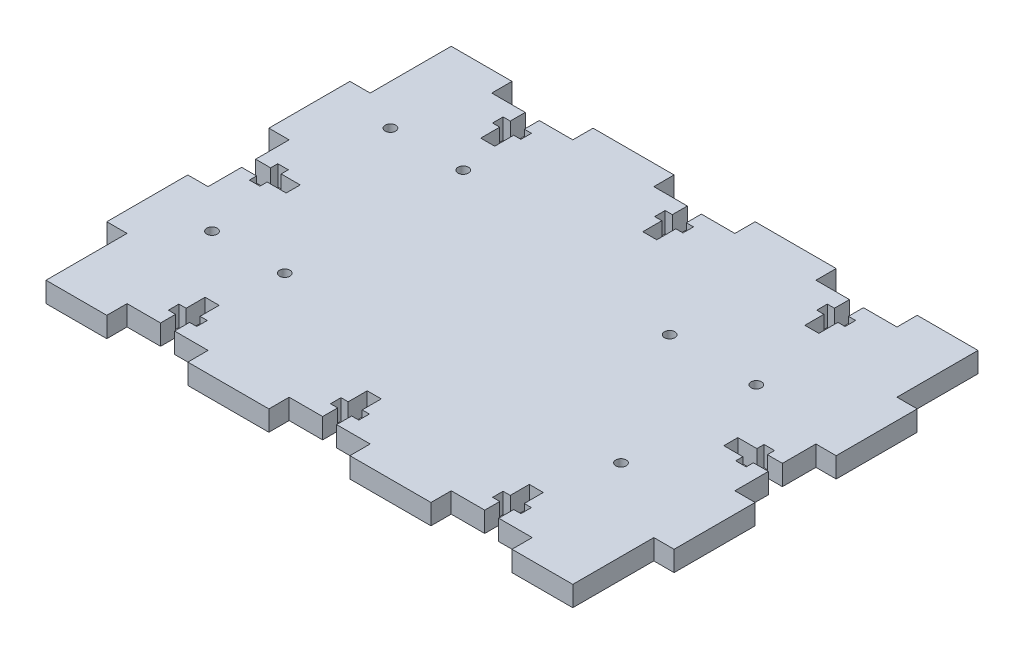
from build123d import *

# Parameters (mm, degrees)
SKETCH1_W                 = 177.8
SKETCH1_H                 = 127
BOSS_EXTRUDE1_DEPTH       = 6.35
SKETCH2_W                 = 6.35
SKETCH2_H                 = 25.4
CUT_EXTRUDE1_DEPTH        = 6.35
LPATTERN1_COUNT           = 3
LPATTERN1_PITCH           = 50.8
LPATTERN1_COUNT_DIR2      = 2
LPATTERN1_PITCH_DIR2      = 171.45
SKETCH3_W                 = 25.4
SKETCH3_H                 = 6.35
CUT_EXTRUDE2_DEPTH        = 6.35
LPATTERN2_COUNT           = 3
LPATTERN2_PITCH           = 50.8
LPATTERN2_COUNT_DIR2      = 2
LPATTERN2_PITCH_DIR2      = 120.65
SKETCH4_W                 = 13.97
SKETCH4_H                 = 4.3942
SKETCH4_W_2               = 3.302
SKETCH4_H_2               = 8.89
CUT_EXTRUDE3_DEPTH        = 8.89
SKETCH5_W                 = 4.3942
SKETCH5_H                 = 13.97
SKETCH5_W_2               = 8.89
SKETCH5_H_2               = 3.302
CUT_EXTRUDE4_DEPTH        = 30.48
LPATTERN3_COUNT           = 3
LPATTERN3_PITCH           = 50.8
MIRROR2_COPY_1_SKETCH_W   = 4.3942
MIRROR2_COPY_1_SKETCH_H   = 13.97
MIRROR2_COPY_1_SKETCH_W_2 = 8.89
MIRROR2_COPY_1_SKETCH_H_2 = 3.302
MIRROR2_COPY_1_DEPTH      = 30.48
MIRROR2_COPY_2_SKETCH_W   = 4.3942
MIRROR2_COPY_2_SKETCH_H   = 13.97
MIRROR2_COPY_2_SKETCH_W_2 = 8.89
MIRROR2_COPY_2_SKETCH_H_2 = 3.302
MIRROR2_COPY_2_DEPTH      = 30.48
MIRROR2_COPY_3_SKETCH_W   = 4.3942
MIRROR2_COPY_3_SKETCH_H   = 13.97
MIRROR2_COPY_3_SKETCH_W_2 = 8.89
MIRROR2_COPY_3_SKETCH_H_2 = 3.302
MIRROR2_COPY_3_DEPTH      = 30.48
F_4_CLEARANCE_HOLE2_D     = 3.2639
F_4_CLEARANCE_HOLE2_DEPTH = 10.16
F_4_CLEARANCE_HOLE2_TIP   = 0.980574487
F_4_CLEARANCE_HOLE3_D     = 3.2639
F_4_CLEARANCE_HOLE3_DEPTH = 10.16
F_4_CLEARANCE_HOLE3_TIP   = 0.980574487


with BuildPart() as part:
    # Sketch1 → Boss-Extrude1 (new body)
    with BuildSketch(Plane(origin=(0, 0, 0), x_dir=(1, 0, 0), z_dir=(0, 1, 0))):
        with Locations((88.9, 63.5)):
            Rectangle(SKETCH1_W, SKETCH1_H)
    extrude(amount=BOSS_EXTRUDE1_DEPTH)

    # Sketch2 → Cut-Extrude1 (cut)
    with BuildSketch(Plane(origin=(0, 6.35, 0), x_dir=(1, 0, 0), z_dir=(0, 1, 0))):
        with Locations((3.175, 114.3)):
            Rectangle(SKETCH2_W, SKETCH2_H)
    cut_extrude1 = extrude(amount=-CUT_EXTRUDE1_DEPTH, mode=Mode.SUBTRACT)

    # LPattern1: Cut-Extrude1 3 × 2
    with Locations(*[(j * LPATTERN1_PITCH_DIR2, 0, i * LPATTERN1_PITCH) for i in range(LPATTERN1_COUNT) for j in range(LPATTERN1_COUNT_DIR2) if (i, j) != (0, 0)]):
        add(cut_extrude1, mode=Mode.SUBTRACT)

    # Sketch3 → Cut-Extrude2 (cut)
    with BuildSketch(Plane(origin=(0, 6.35, 0), x_dir=(1, 0, 0), z_dir=(0, 1, 0))):
        with Locations((38.1, 3.175)):
            Rectangle(SKETCH3_W, SKETCH3_H)
    cut_extrude2 = extrude(amount=-CUT_EXTRUDE2_DEPTH, mode=Mode.SUBTRACT)

    # LPattern2: Cut-Extrude2 3 × 2
    with Locations(*[(i * LPATTERN2_PITCH, 0, -j * LPATTERN2_PITCH_DIR2) for i in range(LPATTERN2_COUNT) for j in range(LPATTERN2_COUNT_DIR2) if (i, j) != (0, 0)]):
        add(cut_extrude2, mode=Mode.SUBTRACT)

    # Sketch4 → Cut-Extrude3 (cut)
    with BuildSketch(Plane(origin=(0, 6.35, 0), x_dir=(1, 0, 0), z_dir=(0, 1, 0))):
        with Locations((164.465, 63.5)):
            Rectangle(SKETCH4_W, SKETCH4_H)
        with Locations((165.1, 63.5)):
            Rectangle(SKETCH4_W_2, SKETCH4_H_2)
    cut_extrude3 = extrude(amount=-CUT_EXTRUDE3_DEPTH, mode=Mode.SUBTRACT)

    # Mirror1: Cut-Extrude3 across plane
    add(cut_extrude3.mirror(Plane(origin=(88.9, 0, 0), x_dir=(0, 0, 1), z_dir=(1, 0, 0))), mode=Mode.SUBTRACT)

    # Sketch5 → Cut-Extrude4 (cut)
    with BuildSketch(Plane(origin=(0, 6.35, 0), x_dir=(1, 0, 0), z_dir=(0, 1, 0))):
        with Locations((38.1, 13.335)):
            Rectangle(SKETCH5_W, SKETCH5_H)
        with Locations((38.1, 12.7)):
            Rectangle(SKETCH5_W_2, SKETCH5_H_2)
    cut_extrude4 = extrude(amount=-CUT_EXTRUDE4_DEPTH, mode=Mode.SUBTRACT)

    # LPattern3: Cut-Extrude4 ×3
    with Locations(*[(i * LPATTERN3_PITCH, 0, 0) for i in range(1, LPATTERN3_COUNT)]):
        add(cut_extrude4, mode=Mode.SUBTRACT)

    # Mirror2 copy 1 sketch → Mirror2 copy 1 (cut)
    with BuildSketch(Plane(origin=(50.8, 6.35, -127), x_dir=(1, 0, 0), z_dir=(0, 1, 0))):
        with Locations((38.1, -13.335)):
            Rectangle(MIRROR2_COPY_1_SKETCH_W, MIRROR2_COPY_1_SKETCH_H)
        with Locations((38.1, -12.7)):
            Rectangle(MIRROR2_COPY_1_SKETCH_W_2, MIRROR2_COPY_1_SKETCH_H_2)
    extrude(amount=-MIRROR2_COPY_1_DEPTH, mode=Mode.SUBTRACT)

    # Mirror2 copy 2 sketch → Mirror2 copy 2 (cut)
    with BuildSketch(Plane(origin=(101.6, 6.35, -127), x_dir=(1, 0, 0), z_dir=(0, 1, 0))):
        with Locations((38.1, -13.335)):
            Rectangle(MIRROR2_COPY_2_SKETCH_W, MIRROR2_COPY_2_SKETCH_H)
        with Locations((38.1, -12.7)):
            Rectangle(MIRROR2_COPY_2_SKETCH_W_2, MIRROR2_COPY_2_SKETCH_H_2)
    extrude(amount=-MIRROR2_COPY_2_DEPTH, mode=Mode.SUBTRACT)

    # Mirror2 copy 3 sketch → Mirror2 copy 3 (cut)
    with BuildSketch(Plane(origin=(0, 6.35, -127), x_dir=(1, 0, 0), z_dir=(0, 1, 0))):
        with Locations((38.1, -13.335)):
            Rectangle(MIRROR2_COPY_3_SKETCH_W, MIRROR2_COPY_3_SKETCH_H)
        with Locations((38.1, -12.7)):
            Rectangle(MIRROR2_COPY_3_SKETCH_W_2, MIRROR2_COPY_3_SKETCH_H_2)
    extrude(amount=-MIRROR2_COPY_3_DEPTH, mode=Mode.SUBTRACT)

    # #4 Clearance Hole2
    with Locations(Plane(origin=(0, 6.35, 0), x_dir=(1, 0, 0), z_dir=(0, 1, 0))):
        with Locations((19.05, 95.25), (41.8592, 95.25), (41.8592, 39.3192), (19.05, 39.3192)):
            Hole(F_4_CLEARANCE_HOLE2_D / 2, depth=F_4_CLEARANCE_HOLE2_DEPTH)
            with Locations((0, 0, -(F_4_CLEARANCE_HOLE2_DEPTH + F_4_CLEARANCE_HOLE2_TIP / 2))):  # 118° drill point
                Cone(0, F_4_CLEARANCE_HOLE2_D / 2, F_4_CLEARANCE_HOLE2_TIP, mode=Mode.SUBTRACT)

    # #4 Clearance Hole3
    with Locations(Plane(origin=(0, 6.35, 0), x_dir=(1, 0, 0), z_dir=(0, 1, 0))):
        with Locations((118.872, 82.931), (146.05, 82.931), (146.05, 40.513)):
            Hole(F_4_CLEARANCE_HOLE3_D / 2, depth=F_4_CLEARANCE_HOLE3_DEPTH)
            with Locations((0, 0, -(F_4_CLEARANCE_HOLE3_DEPTH + F_4_CLEARANCE_HOLE3_TIP / 2))):  # 118° drill point
                Cone(0, F_4_CLEARANCE_HOLE3_D / 2, F_4_CLEARANCE_HOLE3_TIP, mode=Mode.SUBTRACT)


solid = part.part
